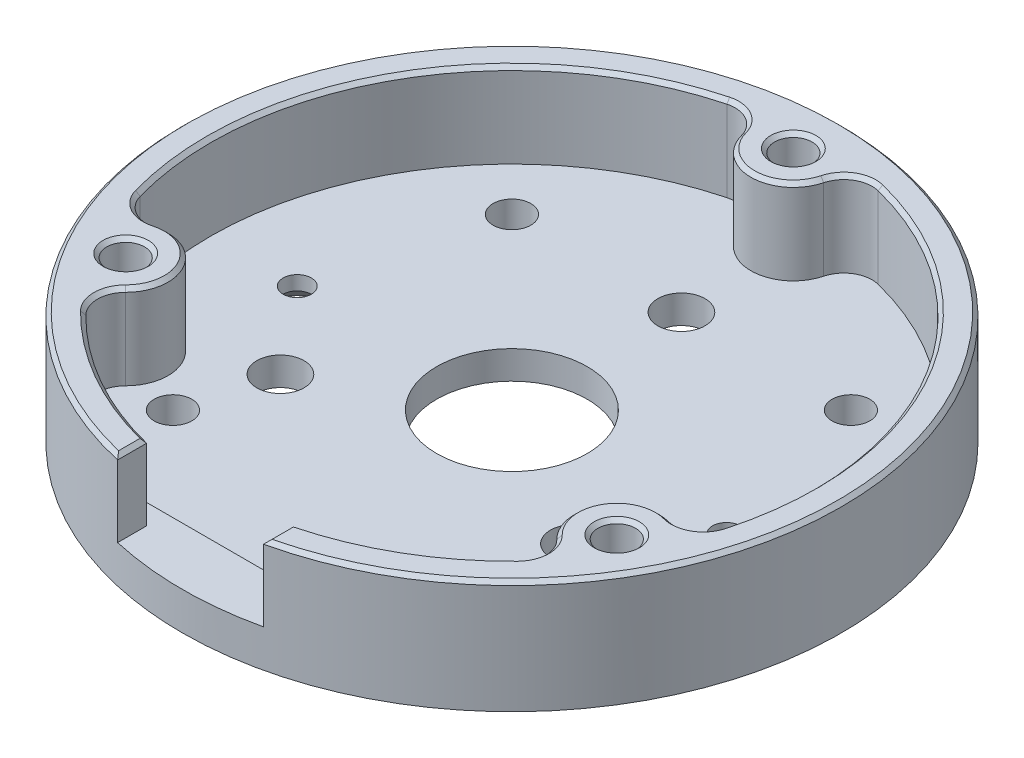
from build123d import *

# Parameters (mm, degrees)
SKETCH_1_R          = 35
SKETCH_1_R_2        = 8
EXTRUDE_1_DEPTH     = 3
SKETCH_2_R          = 35
SKETCH_2_R_2        = 2
EXTRUDE_2_DEPTH     = 9
SKETCH_3_R          = 1.5
CUT_EXTRUDE_1_DEPTH = 8
SKETCH_4_R          = 2.50640253
CUT_EXTRUDE_2_DEPTH = 8
SKETCH_7_R          = 2
CUT_EXTRUDE_4_DEPTH = 12
EXTRUDE_4_DEPTH     = 1
SKETCH_9_W          = 15.497656666
SKETCH_9_H          = 9.48184561
CUT_EXTRUDE_5_DEPTH = 11
CHAMFER_1_SIZE      = 0.4
CHAMFER_2_SIZE      = 1.5


with BuildPart() as part:
    # Эскиз1 → Бобышка-Вытянуть1 (new body)
    with BuildSketch(Plane(origin=(0, 0, 0), x_dir=(1, 0, 0), z_dir=(0, 1, 0))):
        Circle(SKETCH_1_R)
        Circle(SKETCH_1_R_2, mode=Mode.SUBTRACT)
    extrude(amount=EXTRUDE_1_DEPTH)

    # Эскиз2 → Бобышка-Вытянуть2 (add)
    with BuildSketch(Plane(origin=(0, 3, 0), x_dir=(1, 0, 0), z_dir=(0, 1, 0))):
        Circle(SKETCH_2_R)
        with Locations((-0.113661048, 30)):
            Circle(SKETCH_2_R_2, mode=Mode.SUBTRACT)
        with Locations((26.037592637, -14.901566645)):
            Circle(SKETCH_2_R_2, mode=Mode.SUBTRACT)
        with Locations((-25.92393159, -15.098433355)):
            Circle(SKETCH_2_R_2, mode=Mode.SUBTRACT)
        with BuildLine():
            ThreePointArc((-8.117111797, 30.953392319), (-27.773232815, 15.894890343), (-30.80008796, -8.680701679))
            ThreePointArc((-30.80008796, -8.680701679), (-29.387206086, -10.479447295), (-27.117120464, -10.75950488))
            ThreePointArc((-27.117120464, -10.75950488), (-22.03536976, -12.833684606), (-22.738725961, -18.277185484))
            ThreePointArc((-22.738725961, -18.277185484), (-23.615248532, -20.389868414), (-22.747868184, -22.506321181))
            ThreePointArc((-22.747868184, -22.506321181), (0.121237581, -31.999770334), (22.917752157, -22.333307773))
            ThreePointArc((22.917752157, -22.333307773), (23.769070618, -20.210343369), (22.87656479, -18.10436276))
            ThreePointArc((22.87656479, -18.10436276), (22.131981773, -12.666347691), (27.197869919, -10.55372159))
            ThreePointArc((27.197869919, -10.55372159), (29.465768293, -10.256470938), (30.86497998, -8.447071138))
            ThreePointArc((30.86497998, -8.447071138), (27.651995235, 16.104879992), (7.882335804, 31.014009452))
            ThreePointArc((7.882335804, 31.014009452), (5.618135468, 30.689790665), (4.240555674, 28.863867639))
            ThreePointArc((4.240555674, 28.863867639), (-0.096612013, 25.500032297), (-4.459143958, 28.830907074))
            ThreePointArc((-4.459143958, 28.830907074), (-5.850519761, 30.646339352), (-8.117111797, 30.953392319))
        make_face(mode=Mode.SUBTRACT)
    extrude(amount=EXTRUDE_2_DEPTH)

    # Эскиз3 → Вырез-Вытянуть1 (cut)
    with BuildSketch(Plane(origin=(0, 3, 0), x_dir=(1, 0, 0), z_dir=(0, 1, 0))):
        with Locations((22.8, 0)):
            Circle(SKETCH_3_R)
        with Locations((-22.8, 0)):
            Circle(SKETCH_3_R)
    extrude(amount=-CUT_EXTRUDE_1_DEPTH, mode=Mode.SUBTRACT)

    # Эскиз4 → Вырез-Вытянуть2 (cut)
    with BuildSketch(Plane(origin=(0, 3, 0), x_dir=(1, 0, 0), z_dir=(0, 1, 0))):
        with Locations((0, 18)):
            Circle(SKETCH_4_R)
        with Locations((15.588457268, -9)):
            Circle(SKETCH_4_R)
        with Locations((-15.588457268, -9)):
            Circle(SKETCH_4_R)
    extrude(amount=-CUT_EXTRUDE_2_DEPTH, mode=Mode.SUBTRACT)

    # Эскиз7 → Вырез-Вытянуть4 (cut)
    with BuildSketch(Plane(origin=(0, 3, 0), x_dir=(1, 0, 0), z_dir=(0, 1, 0))):
        with Locations((-18, -18)):
            Circle(SKETCH_7_R)
        with Locations((18, -18)):
            Circle(SKETCH_7_R)
        with Locations((-18, 18)):
            Circle(SKETCH_7_R)
        with Locations((18, 18)):
            Circle(SKETCH_7_R)
    extrude(amount=-CUT_EXTRUDE_4_DEPTH, mode=Mode.SUBTRACT)

    # Эскиз8 → Бобышка-Вытянуть4 (add)
    with BuildSketch(Plane(origin=(0, 3, 0), x_dir=(1, 0, 0), z_dir=(0, 1, 0))):
        with BuildLine():
            Line((-13.748828333, -28.895842598), (13.748828333, -28.895842598))
            ThreePointArc((13.748828333, -28.895842598), (0, -32), (-13.748828333, -28.895842598))
        make_face()
    extrude(amount=EXTRUDE_4_DEPTH)

    # Эскиз9 → Вырез-Вытянуть5 (cut)
    with BuildSketch(Plane(origin=(0, 0, 28.895842598), x_dir=(-1, 0, 0), z_dir=(0, 0, -1))):
        with Locations((0, 8.740922805)):
            Rectangle(SKETCH_9_W, SKETCH_9_H)
    extrude(amount=-CUT_EXTRUDE_5_DEPTH, mode=Mode.SUBTRACT)

    # Фаска1
    chamfer_1_edges = [part.edges().sort_by_distance(p)[0] for p in [
        (-27.92393159, 12, 15.098433355),
        (-2.113661048, 12, -30),
        (24.037592637, 12, 14.901566645),
        (15.940347108, 12, 27.747168037),
        (23.769070618, 12, 20.210343369),
        (22.131981773, 12, 12.666347691),
        (29.465768293, 12, 10.256470938),
        (27.651995235, 12, -16.104879992),
        (5.618135468, 12, -30.689790665),
        (-0.096612013, 12, -25.500032297),
        (-5.850519761, 12, -30.646339352),
        (-27.773232815, 12, -15.894890343),
        (-29.387206086, 12, 10.479447295),
        (-22.03536976, 12, 12.833684606),
        (-23.615248532, 12, 20.389868414),
        (-15.835107718, 12, 27.807361679),
        (-7.748828333, 12, 32.589541055),
        (-21.837937269, 12, -27.351498969),
        (7.748828333, 12, 32.589541055),
    ]]
    chamfer(chamfer_1_edges, length=CHAMFER_1_SIZE)

    # Фаска2
    chamfer_2_edges = [part.edges().sort_by_distance(p)[0] for p in [
        (21.3, 0, 0),
        (-24.3, 0, 0),
    ]]
    chamfer(chamfer_2_edges, length=CHAMFER_2_SIZE)


solid = part.part
